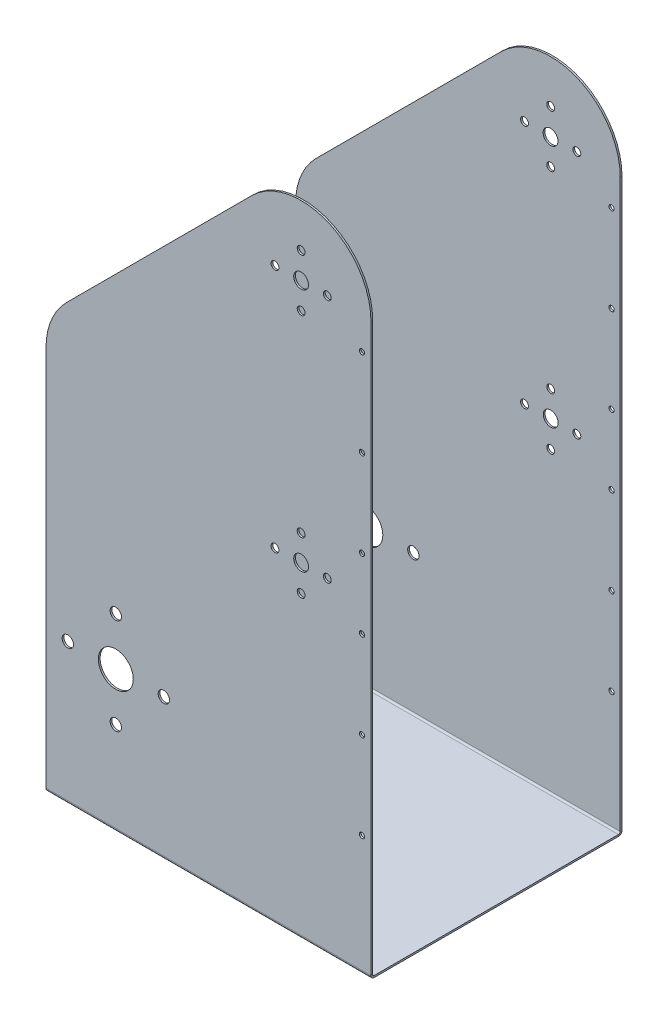
from build123d import *

# Parameters (mm, degrees)
SKETCH1_W                = 186.07
SKETCH1_H                = 140
BASE_FLANGE1_DEPTH       = 1
EDGE_FLANGE1_DEPTH       = 186.07
EDGE_FLANGE1_START       = 1
EDGE_FLANGE1_PROFILE_R   = 2.25
EDGE_FLANGE1_PROFILE_R_2 = 4.25
EDGE_FLANGE1_PROFILE_R_3 = 3.25
EDGE_FLANGE1_PROFILE_R_4 = 10
EDGE_FLANGE1_FLAT_DEPTH  = 1
EDGE_FLANGE2_DEPTH       = 186.07
EDGE_FLANGE2_START       = 1
EDGE_FLANGE2_PROFILE_R   = 3.25
EDGE_FLANGE2_PROFILE_R_2 = 10
EDGE_FLANGE2_PROFILE_R_3 = 2.25
EDGE_FLANGE2_PROFILE_R_4 = 4.25
EDGE_FLANGE2_FLAT_DEPTH  = 1
SKETCH21_R               = 1.5
CUT_EXTRUDE1_DEPTH       = 144


# Sheet-metal steps are written as plain solids
with BuildPart() as part:
    # Sketch1 → Base-Flange1 (new body)
    with BuildSketch(Plane(origin=(0, 0, 0), x_dir=(1, 0, 0), z_dir=(0, 1, 0))):
        with Locations((93.035, 70)):
            Rectangle(SKETCH1_W, SKETCH1_H)
    extrude(amount=-BASE_FLANGE1_DEPTH)

    # Edge-Flange1 bend section (across the edge) → Edge-Flange1 (add)
    with BuildSketch(Plane(origin=(0, 0, 1), x_dir=(0, 0, -1), z_dir=(1, 0, 0))):
        with BuildLine():
            Line((-1, 1), (0, 1))
            ThreePointArc((0, 1), (0.292893219, 0.292893219), (1, 0))
            Line((1, 0), (1, -1))
            ThreePointArc((1, -1), (-0.414213562, -0.414213562), (-1, 1))
        make_face()
    extrude(amount=EDGE_FLANGE1_DEPTH)

    # Edge-Flange1 profile (on flange) → Edge-Flange1 flat (add)
    with BuildSketch(Plane.XY.offset(1).offset(EDGE_FLANGE1_START)):
        with BuildLine():
            ThreePointArc((186.202497932, 325.709852824), (161.420468776, 362.701924453), (117.781829762, 353.857066198))
            Line((117.781829762, 353.857066198), (11.715746401, 247.791115203))
            ThreePointArc((11.715746401, 247.791115203), (3.044823475, 234.814175131), (0, 219.506826307))
            Line((0, 219.506826307), (0, 1))
            Line((0, 1), (186.202497932, 1))
            Line((186.202497932, 1), (186.202497932, 185.709852824))
            Line((186.202497932, 185.709852824), (186.202497932, 325.709852824))
        make_face()
        with Locations((146.20256152, 170.709852824)):
            Circle(EDGE_FLANGE1_PROFILE_R, mode=Mode.SUBTRACT)
        with Locations((161.20256152, 185.709852824)):
            Circle(EDGE_FLANGE1_PROFILE_R, mode=Mode.SUBTRACT)
        with Locations((146.202497932, 185.92936058)):
            Circle(EDGE_FLANGE1_PROFILE_R_2, mode=Mode.SUBTRACT)
        with Locations((131.20256152, 185.709852824)):
            Circle(EDGE_FLANGE1_PROFILE_R, mode=Mode.SUBTRACT)
        with Locations((67.5, 80)):
            Circle(EDGE_FLANGE1_PROFILE_R_3, mode=Mode.SUBTRACT)
        with Locations((40, 52.5)):
            Circle(EDGE_FLANGE1_PROFILE_R_3, mode=Mode.SUBTRACT)
        with Locations((40, 80)):
            Circle(EDGE_FLANGE1_PROFILE_R_4, mode=Mode.SUBTRACT)
        with Locations((12.5, 80)):
            Circle(EDGE_FLANGE1_PROFILE_R_3, mode=Mode.SUBTRACT)
        with Locations((40, 107.5)):
            Circle(EDGE_FLANGE1_PROFILE_R_3, mode=Mode.SUBTRACT)
        with Locations((146.20256152, 200.709852824)):
            Circle(EDGE_FLANGE1_PROFILE_R, mode=Mode.SUBTRACT)
        with Locations((146.2030357, 310.929360579)):
            Circle(EDGE_FLANGE1_PROFILE_R, mode=Mode.SUBTRACT)
        with Locations((161.203100232, 325.929360579)):
            Circle(EDGE_FLANGE1_PROFILE_R, mode=Mode.SUBTRACT)
        with Locations((146.203100232, 325.929360579)):
            Circle(EDGE_FLANGE1_PROFILE_R_2, mode=Mode.SUBTRACT)
        with Locations((146.203100232, 340.929360579)):
            Circle(EDGE_FLANGE1_PROFILE_R, mode=Mode.SUBTRACT)
        with Locations((131.203100232, 325.929360579)):
            Circle(EDGE_FLANGE1_PROFILE_R, mode=Mode.SUBTRACT)
    extrude(amount=-EDGE_FLANGE1_FLAT_DEPTH)

    # Edge-Flange2 bend section (across the edge) → Edge-Flange2 (add)
    with BuildSketch(Plane(origin=(186.07, 0, -141), x_dir=(0, 0, 1), z_dir=(-1, 0, 0))):
        with BuildLine():
            Line((-1, 1), (0, 1))
            ThreePointArc((0, 1), (0.292893219, 0.292893219), (1, 0))
            Line((1, 0), (1, -1))
            ThreePointArc((1, -1), (-0.414213562, -0.414213562), (-1, 1))
        make_face()
    extrude(amount=EDGE_FLANGE2_DEPTH)

    # Edge-Flange2 profile (on flange) → Edge-Flange2 flat (add)
    with BuildSketch(Plane(origin=(0, 0, -141), x_dir=(-1, 0, 0), z_dir=(0, 0, -1)).offset(EDGE_FLANGE2_START)):
        with BuildLine():
            ThreePointArc((-117.781829762, 353.857066198), (-161.347263599, 362.640665891), (-186.07, 325.709852824))
            Line((-186.07, 325.709852824), (-186.07, 1))
            Line((-186.07, 1), (0, 1))
            Line((0, 1), (0, 219.506826307))
            ThreePointArc((0, 219.506826307), (-3.044823475, 234.814175131), (-11.715746401, 247.791115203))
            Line((-11.715746401, 247.791115203), (-117.781829762, 353.857066198))
        make_face()
        with Locations((-12.5, 80)):
            Circle(EDGE_FLANGE2_PROFILE_R, mode=Mode.SUBTRACT)
        with Locations((-40, 52.5)):
            Circle(EDGE_FLANGE2_PROFILE_R, mode=Mode.SUBTRACT)
        with Locations((-40, 80)):
            Circle(EDGE_FLANGE2_PROFILE_R_2, mode=Mode.SUBTRACT)
        with Locations((-40, 107.5)):
            Circle(EDGE_FLANGE2_PROFILE_R, mode=Mode.SUBTRACT)
        with Locations((-67.5, 80)):
            Circle(EDGE_FLANGE2_PROFILE_R, mode=Mode.SUBTRACT)
        with Locations((-131.20256152, 185.709852824)):
            Circle(EDGE_FLANGE2_PROFILE_R_3, mode=Mode.SUBTRACT)
        with Locations((-146.20256152, 170.709852824)):
            Circle(EDGE_FLANGE2_PROFILE_R_3, mode=Mode.SUBTRACT)
        with Locations((-146.202497932, 185.92936058)):
            Circle(EDGE_FLANGE2_PROFILE_R_4, mode=Mode.SUBTRACT)
        with Locations((-161.20256152, 185.709852824)):
            Circle(EDGE_FLANGE2_PROFILE_R_3, mode=Mode.SUBTRACT)
        with Locations((-146.20256152, 200.709852824)):
            Circle(EDGE_FLANGE2_PROFILE_R_3, mode=Mode.SUBTRACT)
        with Locations((-131.203100232, 325.929360579)):
            Circle(EDGE_FLANGE2_PROFILE_R_3, mode=Mode.SUBTRACT)
        with Locations((-146.2030357, 310.929360579)):
            Circle(EDGE_FLANGE2_PROFILE_R_3, mode=Mode.SUBTRACT)
        with Locations((-146.125015413, 325.709852824)):
            Circle(EDGE_FLANGE2_PROFILE_R_4, mode=Mode.SUBTRACT)
        with Locations((-146.203100232, 340.929360579)):
            Circle(EDGE_FLANGE2_PROFILE_R_3, mode=Mode.SUBTRACT)
        with Locations((-161.203100232, 325.929360579)):
            Circle(EDGE_FLANGE2_PROFILE_R_3, mode=Mode.SUBTRACT)
    extrude(amount=-EDGE_FLANGE2_FLAT_DEPTH)

    # Sketch21 → Cut-Extrude1 (cut)
    with BuildSketch(Plane(origin=(0, 0, -142), x_dir=(-1, 0, 0), z_dir=(0, 0, -1))):
        with Locations(Location((-181.07, 118, 0), (0, 0, 90))):
            Circle(SKETCH21_R)
        with Locations(Location((-181.07, 168, 0), (0, 0, 90))):
            Circle(SKETCH21_R)
        with Locations(Location((-181.07, 68, 0), (0, 0, 90))):
            Circle(SKETCH21_R)
        with Locations(Location((-181.07, 208, 0), (0, 0, 90))):
            Circle(SKETCH21_R)
        with Locations(Location((-181.07, 258, 0), (0, 0, 90))):
            Circle(SKETCH21_R)
        with Locations(Location((-181.07, 308, 0), (0, 0, 90))):
            Circle(SKETCH21_R)
    extrude(amount=-CUT_EXTRUDE1_DEPTH, mode=Mode.SUBTRACT)


solid = part.part
